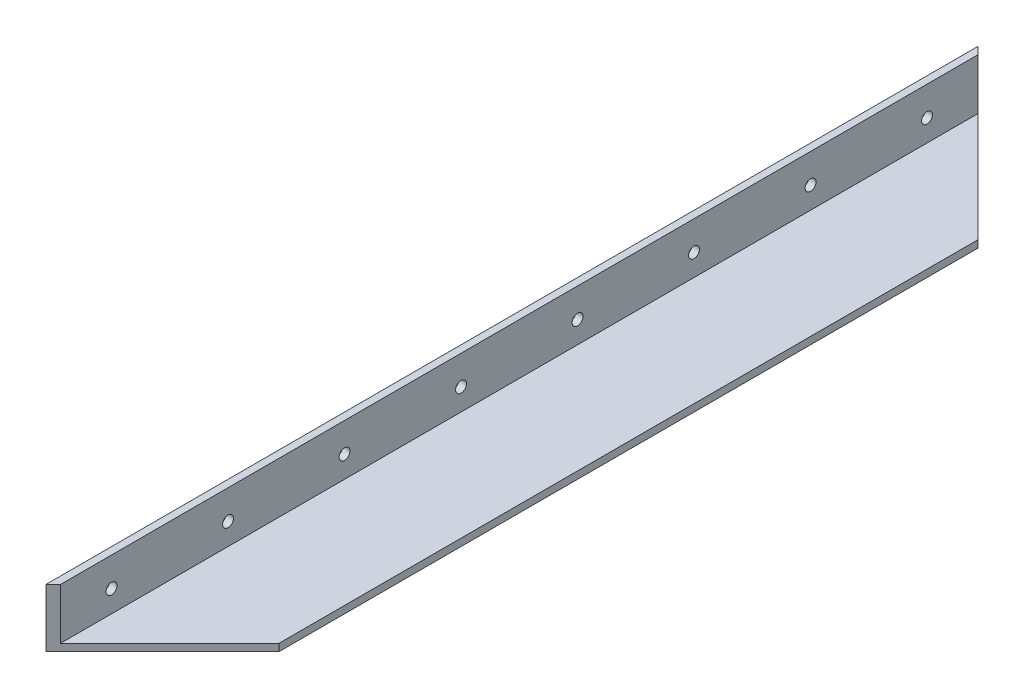
from build123d import *

# Parameters (mm, degrees)
BOSS_EXTRUDE1_DEPTH = 406.4
SKETCH2_R           = 2.38125
CUT_EXTRUDE1_DEPTH  = 411.349558304
CHAMFER1_SIZE       = 50.8
CHAMFER2_SIZE       = 50.8


with BuildPart() as part:
    # Sketch1 → Boss-Extrude1 (new body)
    with BuildSketch(Plane.XY):
        Polygon((0, 25.4), (0, 0), (50.8, 0), (50.8, 3.175), (3.175, 3.175), (3.175, 25.4), align=None)
    extrude(amount=BOSS_EXTRUDE1_DEPTH)

    # Sketch2 → Cut-Extrude1 (cut, through all)
    with BuildSketch(Plane.ZY):
        with Locations((381, 12.7)):
            Circle(SKETCH2_R)
        with Locations((330.2, 12.7)):
            Circle(SKETCH2_R)
        with Locations((279.4, 12.7)):
            Circle(SKETCH2_R)
        with Locations((228.6, 12.7)):
            Circle(SKETCH2_R)
        with Locations((177.8, 12.7)):
            Circle(SKETCH2_R)
        with Locations((127, 12.7)):
            Circle(SKETCH2_R)
        with Locations((76.2, 12.7)):
            Circle(SKETCH2_R)
        with Locations((25.4, 12.7)):
            Circle(SKETCH2_R)
        with Locations((-25.4, 12.7)):
            Circle(SKETCH2_R)
        with Locations((-76.2, 12.7)):
            Circle(SKETCH2_R)
    extrude(amount=-CUT_EXTRUDE1_DEPTH, mode=Mode.SUBTRACT)

    # Chamfer1
    chamfer1_edges = [part.edges().sort_by_distance(p)[0] for p in [
        (50.8, 1.5875, 406.4),
    ]]
    chamfer(chamfer1_edges, length=CHAMFER1_SIZE - 0.0001)  # a hair under: the kernel refuses the full size

    # Chamfer2
    chamfer2_edges = [part.edges().sort_by_distance(p)[0] for p in [
        (50.8, 1.5875, 0),
    ]]
    chamfer(chamfer2_edges, length=CHAMFER2_SIZE - 0.0001)  # a hair under: the kernel refuses the full size


solid = part.part
